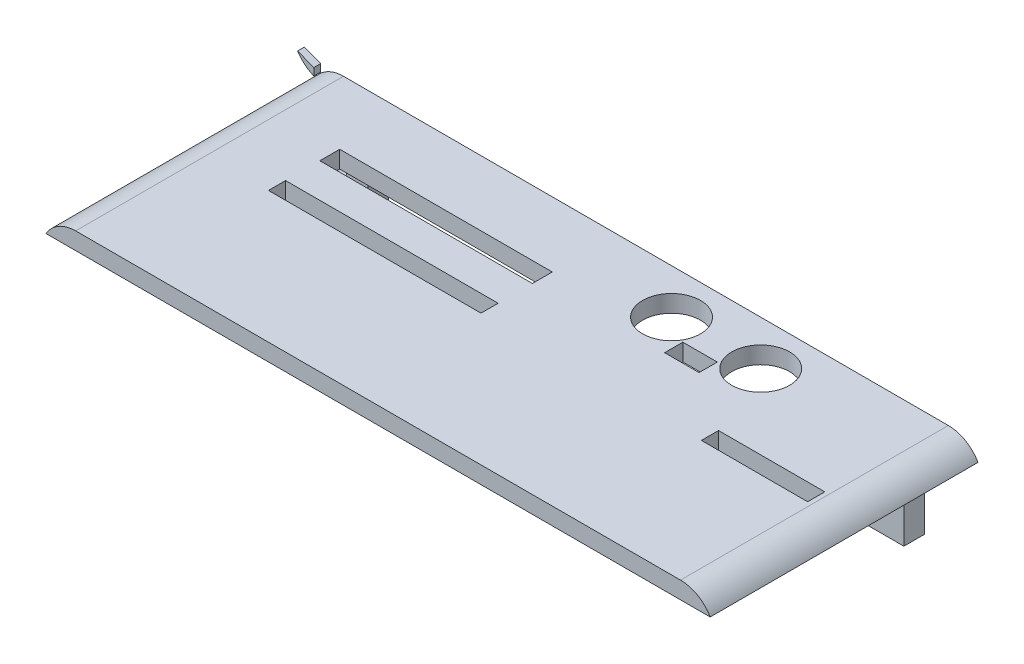
from build123d import *

# Parameters (mm, degrees)
CROQUIS2_W              = 200
CROQUIS2_H              = 150
CROQUIS2_R              = 2
CROQUIS2_R_2            = 2.5
CROQUIS2_W_2            = 31.297292299
CROQUIS2_H_2            = 43.768728426
CROQUIS2_H_3            = 43.768728427
CROQUIS2_W_3            = 23.573907934
CROQUIS2_H_4            = 45.323962431
SALIENTE_EXTRUIR1_DEPTH = 2
REDONDEO1_R             = 10
BOSS_EXTRUDE1_DEPTH     = 25
SKETCH3_W               = 62.040442094
SKETCH3_H               = 5.530821024
BOSS_EXTRUDE2_DEPTH     = 22
SKETCH8_W               = 62.040442094
SKETCH8_H               = 5.530821024
BOSS_EXTRUDE6_DEPTH     = 13
SKETCH2_W               = 193.758392872
SKETCH2_H               = 78.124132015
SKETCH2_W_2             = 62.040442094
SKETCH2_H_2             = 5.530821024
BOSS_EXTRUDE3_DEPTH     = 5
SKETCH4_W               = 62.040442094
SKETCH4_H               = 5.530821024
BOSS_EXTRUDE4_DEPTH     = 19
SKETCH5_W               = 7.442573222
SKETCH5_H               = 2.991451355
BOSS_EXTRUDE5_DEPTH     = 21
SKETCH6_R               = 2.5
CUT_EXTRUDE1_DEPTH      = 158.961544101
FILLET1_R               = 10
SKETCH13_W              = 62.040442094
SKETCH13_H              = 4.214652984
CUT_EXTRUDE6_DEPTH      = 149.758539633
SKETCH14_R              = 2.5
CUT_EXTRUDE7_DEPTH      = 158.961544101
SKETCH11_W              = 62
SKETCH11_H              = 5.8
SKETCH11_H_2            = 5
SKETCH11_W_2            = 193.758392872
SKETCH11_H_3            = 2
SKETCH11_W_3            = 27.3
CUT_EXTRUDE8_DEPTH      = 205.260962853
SKETCH17_W              = 130.161323944
SKETCH17_H              = 157.545365022
CUT_EXTRUDE9_DEPTH      = 149.758539633
CROQUIS5_W              = 3.7
CROQUIS5_H              = 5
CORTAR_EXTRUIR7_DEPTH   = 10
CROQUIS6_W              = 2.991451355
CROQUIS6_H              = 21
SALIENTE_EXTRUIR2_DEPTH = 5
CROQUIS7_W              = 12.442573222
CROQUIS7_H              = 2.991451355
SALIENTE_EXTRUIR3_DEPTH = 5
CROQUIS8_W              = 12.442573222
CROQUIS8_H              = 26
SALIENTE_EXTRUIR4_DEPTH = 3
CROQUIS9_R              = 2.5
CORTAR_EXTRUIR8_DEPTH   = 16
CROQUIS11_W             = 2.991451355
CROQUIS11_H             = 21
SALIENTE_EXTRUIR5_DEPTH = 5
CROQUIS12_W             = 12.442573222
CROQUIS12_H             = 2.991451355
SALIENTE_EXTRUIR6_DEPTH = 5
CROQUIS13_W             = 12.442573222
CROQUIS13_H             = 26
SALIENTE_EXTRUIR7_DEPTH = 3
CROQUIS14_R             = 2.5
CORTAR_EXTRUIR9_DEPTH   = 15
CROQUIS15_W             = 10.045182272
CROQUIS15_H             = 5.32
CROQUIS15_R             = 8.45
CORTAR_EXTRUIR10_DEPTH  = 15


with BuildPart() as part:
    # Croquis2 → Saliente-Extruir1 (new body)
    with BuildSketch(Plane.XY):
        with Locations((0.108263467, -0.36008145)):
            Rectangle(CROQUIS2_W, CROQUIS2_H)
        with Locations((89.108263467, -66.5)):
            Circle(CROQUIS2_R, mode=Mode.SUBTRACT)
        with Locations((-88.891736533, -66.5)):
            Circle(CROQUIS2_R, mode=Mode.SUBTRACT)
        with Locations(Location((89.108263467, 65.779837101, 0), (0, 0, 180))):
            Circle(CROQUIS2_R, mode=Mode.SUBTRACT)
        with Locations(Location((-88.891736533, 65.779837101, 0), (0, 0, 180))):
            Circle(CROQUIS2_R, mode=Mode.SUBTRACT)
        with Locations((-80.865436179, -59.36008145)):
            Circle(CROQUIS2_R_2, mode=Mode.SUBTRACT)
        with Locations((81.108263467, -59.36008145)):
            Circle(CROQUIS2_R_2, mode=Mode.SUBTRACT)
        with Locations(Location((81.108263467, 58.63991855, 0), (0, 0, 180))):
            Circle(CROQUIS2_R_2, mode=Mode.SUBTRACT)
        with Locations(Location((-80.865436179, 58.63991855, 0), (0, 0, 180))):
            Circle(CROQUIS2_R_2, mode=Mode.SUBTRACT)
        with BuildLine():
            Line((-62.091736533, 70.63991855), (64.108263467, 70.63991855))
            ThreePointArc((64.108263467, 70.63991855), (66.108263467, 68.63991855), (64.108263467, 66.63991855))
            Line((64.108263467, 66.63991855), (-62.091736533, 66.63991855))
            ThreePointArc((-62.091736533, 66.63991855), (-64.091736533, 68.63991855), (-62.091736533, 70.63991855))
        make_face(mode=Mode.SUBTRACT)
        Polygon((-71.391736533, -12.902447307), (-71.391736533, 12.182284408), (-79.241736533, 12.28991855), (-83.891736533, 12.28991855), (-83.891736533, -13.01008145), (-79.241736533, -13.01008145), align=None, mode=Mode.SUBTRACT)
        with BuildLine():
            Line((92.108263467, 45.478381757), (92.108263467, -46.198544657))
            ThreePointArc((92.108263467, -46.198544657), (90.807295546, -47.897576736), (89.108263467, -46.596608814))
            Line((89.108263467, -46.596608814), (89.108263467, 45.876445915))
            ThreePointArc((89.108263467, 45.876445915), (90.807295546, 47.177413836), (92.108263467, 45.478381757))
        make_face(mode=Mode.SUBTRACT)
        Polygon((84.108263467, 12.28991855), (84.108263467, -13.01008145), (79.458263467, -13.01008145), (71.608263467, -13.01008145), (71.608263467, 12.28991855), (79.458263467, 12.28991855), align=None, mode=Mode.SUBTRACT)
        with BuildLine():
            Line((-91.891736533, 45.478381757), (-91.891736533, -46.198544657))
            ThreePointArc((-91.891736533, -46.198544657), (-90.590768612, -47.897576736), (-88.891736533, -46.596608814))
            Line((-88.891736533, -46.596608814), (-88.891736533, 45.876445915))
            ThreePointArc((-88.891736533, 45.876445915), (-90.590768612, 47.177413836), (-91.891736533, 45.478381757))
        make_face(mode=Mode.SUBTRACT)
        with Locations((-30.011405388, 36.299005811)):
            Rectangle(CROQUIS2_W_2, CROQUIS2_H_2, mode=Mode.SUBTRACT)
        with BuildLine():
            Line((-62.091736533, -71.36008145), (64.108263467, -71.36008145))
            ThreePointArc((64.108263467, -71.36008145), (66.108263467, -69.36008145), (64.108263467, -67.36008145))
            Line((64.108263467, -67.36008145), (-62.091736533, -67.36008145))
            ThreePointArc((-62.091736533, -67.36008145), (-64.091736533, -69.36008145), (-62.091736533, -71.36008145))
        make_face(mode=Mode.SUBTRACT)
        with Locations((-30.011405388, -26.799059535)):
            Rectangle(CROQUIS2_W_2, CROQUIS2_H_3, mode=Mode.SUBTRACT)
        with Locations((12.982877294, -0.693345879)):
            Rectangle(CROQUIS2_W_3, CROQUIS2_H_4, mode=Mode.SUBTRACT)
    extrude(amount=SALIENTE_EXTRUIR1_DEPTH)

    # Redondeo1
    redondeo1_edges = [part.edges().sort_by_distance(p)[0] for p in [
        (100.108263467, -75.36008145, 1),
        (-99.891736533, -75.36008145, 1),
        (-99.891736533, 74.63991855, 1),
        (100.108263467, 74.63991855, 1),
    ]]
    fillet(redondeo1_edges, radius=REDONDEO1_R)

    # Sketch1 → Boss-Extrude1 (add)
    with BuildSketch(Plane.XY.offset(2)):
        Polygon((-67.071845217, 64.63991855), (-67.071845217, 60.63991855), (-8.841198185, 60.63991855), (-8.841198185, 3.63991855), (-67.071845217, 3.63991855), (-67.071845217, -0.36008145), (-8.841198185, -0.36008145), (-8.841198185, -53.36008145), (-67.071845217, -53.36008145), (-67.071845217, -57.574734434), (-5.031403123, -57.574734434), (-5.031403123, -40.931443482), (46.608263467, -40.931443482), (46.608263467, -36.931443482), (-5.031403123, -36.931443482), (-5.031403123, 30.068556518), (46.608263467, 30.068556518), (46.608263467, 34.068556518), (-5.031403123, 34.068556518), (-5.031403123, 64.63991855), align=None)
    extrude(amount=BOSS_EXTRUDE1_DEPTH)

    # Sketch3 → Boss-Extrude2 (add)
    with BuildSketch(Plane.XZ.offset(57.574734434)):
        with Locations((-36.05162417, 24.234589488)):
            Rectangle(SKETCH3_W, SKETCH3_H)
    extrude(amount=BOSS_EXTRUDE2_DEPTH)

    # Sketch8 → Boss-Extrude6 (add)
    with BuildSketch(Plane(origin=(0, 64.63991855, 0), x_dir=(1, 0, 0), z_dir=(0, 1, 0))):
        with Locations((-36.05162417, -24.234589488)):
            Rectangle(SKETCH8_W, SKETCH8_H)
    extrude(amount=BOSS_EXTRUDE6_DEPTH)

    # Sketch2 → Boss-Extrude3 (add)
    with BuildSketch(Plane.XZ.offset(75.36008145)):
        with Locations((3.229067031, 41.062066008)):
            Rectangle(SKETCH2_W, SKETCH2_H)
        with Locations((-36.05162417, 24.234589488)):
            Rectangle(SKETCH2_W_2, SKETCH2_H_2, mode=Mode.SUBTRACT)
    extrude(amount=-BOSS_EXTRUDE3_DEPTH)

    # Sketch4 → Boss-Extrude4 (add)
    with BuildSketch(Plane(origin=(0, 64.63991855, 0), x_dir=(1, 0, 0), z_dir=(0, 1, 0))):
        with Locations((-36.05162417, -24.234589488)):
            Rectangle(SKETCH4_W, SKETCH4_H)
    extrude(amount=BOSS_EXTRUDE4_DEPTH)

    # Sketch5 → Boss-Extrude5 (add)
    with BuildSketch(Plane.XZ.offset(75.36008145)):
        with Locations((-80.540187187, 3.495725678)):
            Rectangle(SKETCH5_W, SKETCH5_H)
        with Locations((80.756714122, 3.495725678)):
            Rectangle(SKETCH5_W, SKETCH5_H)
    extrude(amount=BOSS_EXTRUDE5_DEPTH)

    # Sketch6 → Cut-Extrude1 (cut, through all)
    with BuildSketch(Plane.XY.offset(4.991451355)):
        with Locations((-80.996023003, -59.284349751)):
            Circle(SKETCH6_R)
        with Locations(Location((85.770332707, -52.138660273, 0), (0, 0, 180))):
            Circle(SKETCH6_R)
        Polygon((-106.504987954, 85.891433433), (-93.566486568, 85.891433433), (-93.566486568, -70.36008145), (-93.650129405, -70.36008145), (-93.650129405, -72.48561093), (-99.134958643, -70.36008145), (-106.504987954, -70.36008145), align=None)
    extrude(amount=-CUT_EXTRUDE1_DEPTH, mode=Mode.SUBTRACT)

    # Fillet1
    # the kernel refuses this fillet: 10 mm, written as the material it takes off along each edge
    with BuildSketch(Plane(origin=(-93.650129405, -70.36008145, 101.77476711), x_dir=(1, 0, 0), z_dir=(0, 0, -1))) as fillet1_piece_1_section:
        with BuildLine():
            CenterArc((8.660254038, 10), FILLET1_R, 210, 60)
            Line((0, 5), (0, 0))
            Line((0, 0), (8.660254038, 0))
        make_face()
    fillet1_piece_1 = extrude(amount=123.425402204, mode=Mode.PRIVATE)
    fillet1_piece_1 = split(fillet1_piece_1, bisect_by=Plane(origin=(-88.735327831, -71.066428463, 2), z_dir=(0, 0, 1)), keep=Keep.TOP, mode=Mode.PRIVATE)
    add(fillet1_piece_1, mode=Mode.SUBTRACT)
    with BuildSketch(Plane(origin=(-93.650129405, -70.36008145, 101.77476711), x_dir=(1, 0, 0), z_dir=(0, 0, -1))) as fillet1_piece_2_section:
        with BuildLine():
            CenterArc((8.660254038, 10), FILLET1_R, 210, 60)
            Line((0, 5), (0, 0))
            Line((0, 0), (8.660254038, 0))
        make_face()
    fillet1_piece_2 = extrude(amount=123.425402204, mode=Mode.PRIVATE)
    fillet1_piece_2 = split(fillet1_piece_2, bisect_by=Plane(origin=(-93.566486568, -71.430970133, 1), z_dir=(-1, 0, 0)), keep=Keep.TOP, mode=Mode.PRIVATE)
    fillet1_piece_2 = split(fillet1_piece_2, bisect_by=Plane(origin=(-93.969016237, -72.362033087, 1), z_dir=(0.36134444351220746, 0.9324324067420936, 0)), keep=Keep.TOP, mode=Mode.PRIVATE)
    add(fillet1_piece_2, mode=Mode.SUBTRACT)
    with BuildSketch(Plane(origin=(100.108263467, -70.36008145, 2), x_dir=(-1, 0, 0), z_dir=(0, 0, 1))) as fillet1_piece_3:
        with BuildLine():
            CenterArc((8.660254038, 10), FILLET1_R, 210, 60)
            Line((0, 5), (0, 0))
            Line((0, 0), (8.660254038, 0))
        make_face()
    extrude(amount=99.77476711, mode=Mode.SUBTRACT)

    # Sketch13 → Cut-Extrude6 (cut, through all)
    with BuildSketch(Plane.XY.offset(27)):
        with Locations((-36.05162417, -77.467407942)):
            Rectangle(SKETCH13_W, SKETCH13_H)
    extrude(amount=-CUT_EXTRUDE6_DEPTH, mode=Mode.SUBTRACT)

    # Sketch14 → Cut-Extrude7 (cut, through all)
    with BuildSketch(Plane.XY.offset(4.991451355)):
        with Locations((-80.594436734, -88.242300615)):
            Circle(SKETCH14_R)
        with Locations((80.746860659, -88.242300615)):
            Circle(SKETCH14_R)
    extrude(amount=-CUT_EXTRUDE7_DEPTH, mode=Mode.SUBTRACT)

    # Sketch11 → Cut-Extrude8 (cut, through all)
    with BuildSketch(Plane.XZ.offset(75.36008145)):
        with Locations((-36.091736533, 23.891451355)):
            Rectangle(SKETCH11_W, SKETCH11_H)
        with Locations((-36.091736533, 39.291451355)):
            Rectangle(SKETCH11_W, SKETCH11_H_2)
        with Locations((3.229067031, 1)):
            Rectangle(SKETCH11_W_2, SKETCH11_H_3)
        with Locations((72.858263467, 39.291451355)):
            Rectangle(SKETCH11_W_3, SKETCH11_H_2)
    extrude(amount=-CUT_EXTRUDE8_DEPTH, mode=Mode.SUBTRACT)


with BuildPart() as cut_extrude8_piece_1:
    # of the separate pieces the step leaves, piece 1, a body of its own (cut_extrude8_pieces)
    add(part.part.solids().sort_by_distance((-84.261473798, -75.36008145, 4.991451355))[0])

    # Sketch17 → Cut-Extrude9 (cut, through all)
    with BuildSketch(Plane.XY.offset(27)):
        with Locations((-14.253473071, 8.412601061)):
            Rectangle(SKETCH17_W, SKETCH17_H)
    extrude(amount=-CUT_EXTRUDE9_DEPTH, mode=Mode.SUBTRACT)

    # Croquis5 → Cortar-Extruir7 (cut)
    with BuildSketch(Plane.XZ.offset(75.36008145)):
        with Locations((88.358263467, 39.291451355)):
            Rectangle(CROQUIS5_W, CROQUIS5_H)
    extrude(amount=-CORTAR_EXTRUIR7_DEPTH, mode=Mode.SUBTRACT)

    # Croquis6 → Saliente-Extruir2 (add)
    with BuildSketch(Plane(origin=(-76.818900576, 0, 0), x_dir=(0, 0, -1), z_dir=(1, 0, 0))):
        with Locations((-3.495725678, -85.86008145)):
            Rectangle(CROQUIS6_W, CROQUIS6_H)
    extrude(amount=SALIENTE_EXTRUIR2_DEPTH)

    # Croquis7 → Saliente-Extruir3 (add)
    with BuildSketch(Plane.XZ.offset(96.36008145)):
        with Locations((-78.040187187, 3.495725678)):
            Rectangle(CROQUIS7_W, CROQUIS7_H)
    extrude(amount=SALIENTE_EXTRUIR3_DEPTH)

    # Croquis8 → Saliente-Extruir4 (add)
    with BuildSketch(Plane.XY.offset(4.991451355)):
        with Locations((-78.040187187, -88.36008145)):
            Rectangle(CROQUIS8_W, CROQUIS8_H)
    extrude(amount=SALIENTE_EXTRUIR4_DEPTH)

    # Croquis9 → Cortar-Extruir8 (cut)
    with BuildSketch(Plane(origin=(0, 0, 2), x_dir=(-1, 0, 0), z_dir=(0, 0, -1))):
        with Locations(Location((80.594436734, -88.242300615, 0), (0, 0, 180))):
            Circle(CROQUIS9_R)
    extrude(amount=-CORTAR_EXTRUIR8_DEPTH, mode=Mode.SUBTRACT)

    # Croquis11 → Saliente-Extruir5 (add)
    with BuildSketch(Plane.ZY.offset(-77.035427511)):
        with Locations((3.495725678, -85.86008145)):
            Rectangle(CROQUIS11_W, CROQUIS11_H)
    extrude(amount=SALIENTE_EXTRUIR5_DEPTH)

    # Croquis12 → Saliente-Extruir6 (add)
    with BuildSketch(Plane.XZ.offset(96.36008145)):
        with Locations((78.256714122, 3.495725678)):
            Rectangle(CROQUIS12_W, CROQUIS12_H)
    extrude(amount=SALIENTE_EXTRUIR6_DEPTH)

    # Croquis13 → Saliente-Extruir7 (add)
    with BuildSketch(Plane.XY.offset(4.991451355)):
        with Locations((78.256714122, -88.36008145)):
            Rectangle(CROQUIS13_W, CROQUIS13_H)
    extrude(amount=SALIENTE_EXTRUIR7_DEPTH)

    # Croquis14 → Cortar-Extruir9 (cut)
    with BuildSketch(Plane(origin=(0, 0, 2), x_dir=(-1, 0, 0), z_dir=(0, 0, -1))):
        with Locations(Location((-80.746860659, -88.242300615, 0), (0, 0, 180))):
            Circle(CROQUIS14_R)
    extrude(amount=-CORTAR_EXTRUIR9_DEPTH, mode=Mode.SUBTRACT)

    # Croquis15 → Cortar-Extruir10 (cut)
    with BuildSketch(Plane(origin=(0, -70.36008145, 0), x_dir=(1, 0, 0), z_dir=(0, 1, 0))):
        with Locations((36.708263467, -22.337318572)):
            Rectangle(CROQUIS15_W, CROQUIS15_H)
        with Locations(Location((49.708263467, -15, 0), (0, 0, 270))):
            Circle(CROQUIS15_R)
        with Locations(Location((23.708263467, -15, 0), (0, 0, 270))):
            Circle(CROQUIS15_R)
    extrude(amount=-CORTAR_EXTRUIR10_DEPTH, mode=Mode.SUBTRACT)


with BuildPart() as cut_extrude8_piece_2:
    # of the separate pieces the step leaves, piece 2, a body of its own (cut_extrude8_pieces)
    add(part.part.solids().sort_by_distance((-93.650129405, -74.626930052, 0))[0])


solid = Compound([cut_extrude8_piece_1.part, cut_extrude8_piece_2.part])
